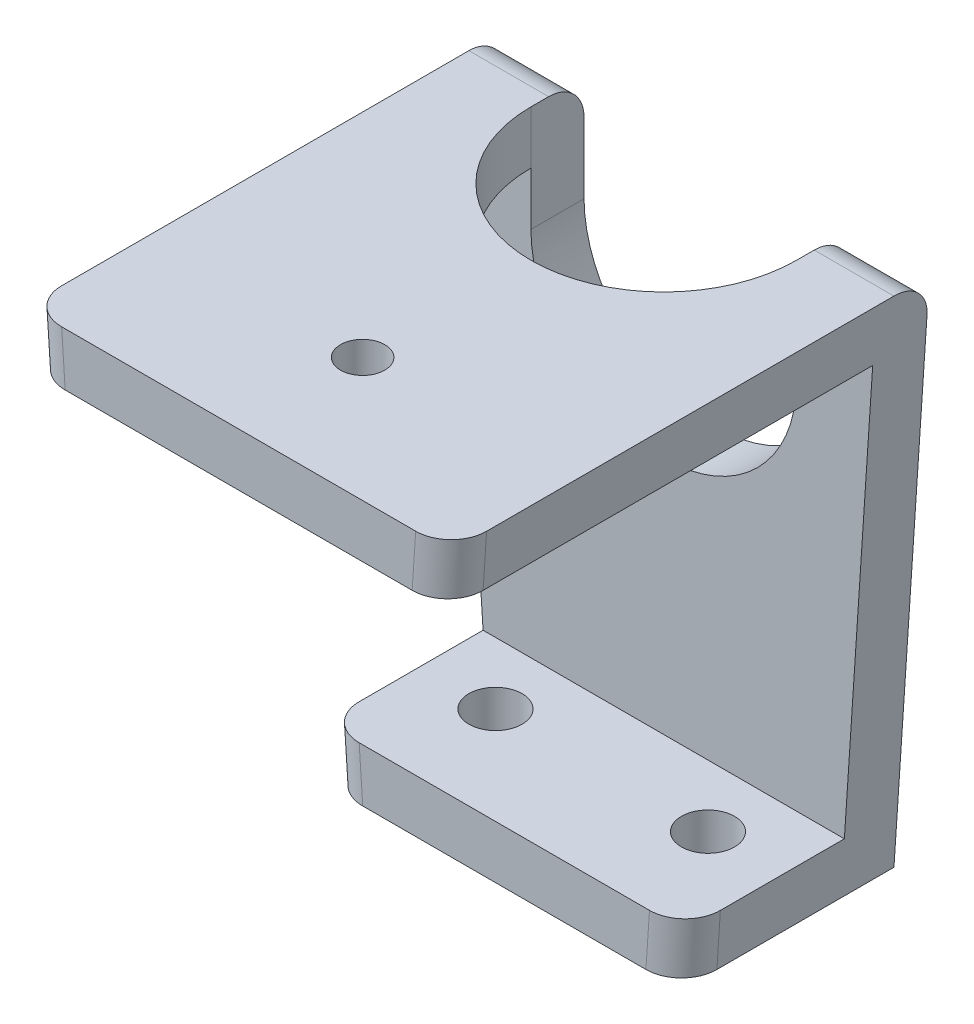
from build123d import *

# Parameters (mm, degrees)
SALIENTE_EXTRUIR1_DEPTH      = 3
SALIENTE_EXTRUIR2_DEPTH      = 9
SALIENTE_EXTRUIR3_DEPTH      = 24
CORTAR_EXTRUIR1_DEPTH        = 3
CORTAR_EXTRUIR_L_MINA1_START = -2.993325909
CORTAR_EXTRUIR_L_MINA1_DEPTH = 2.993325909
REDONDEO1_R                  = 2
CROQUIS6_R                   = 1.25
CORTAR_EXTRUIR2_DEPTH        = 3
CROQUIS7_R                   = 1.5
CORTAR_EXTRUIR3_DEPTH        = 3


# Read off the part's stored shape, not the designer's step: Cortar-Extruir-Lámina1
with BuildPart() as part:
    # Croquis1 → Saliente-Extruir1 (new body)
    with BuildSketch(Plane.XY):
        Polygon((0, 0), (20, 0), (22, 29.933259094), (-2, 29.933259094), align=None)
    extrude(amount=SALIENTE_EXTRUIR1_DEPTH)

    # Croquis2 → Saliente-Extruir2 (add)
    with BuildSketch(Plane.XY.offset(3)):
        Polygon((0, 0), (20, 0), (20.2, 2.993325909), (-0.2, 2.993325909), align=None)
    extrude(amount=SALIENTE_EXTRUIR2_DEPTH)

    # Croquis3 → Saliente-Extruir3 (add)
    with BuildSketch(Plane.XY.offset(3)):
        Polygon((22, 29.933259094), (21.8, 26.939933185), (-1.8, 26.939933185), (-2, 29.933259094), align=None)
    extrude(amount=SALIENTE_EXTRUIR3_DEPTH)

    # Croquis4 → Cortar-Extruir1 (cut)
    with BuildSketch(Plane.XY.offset(3)):
        with BuildLine():
            Line((17.5, 26.939933185), (17.5, 23.939933185))
            ThreePointArc((17.5, 23.939933185), (10, 16.499759469), (2.5, 23.939933185))
            Line((2.5, 23.939933185), (2.5, 26.939933185))
            Line((2.5, 26.939933185), (17.5, 26.939933185))
        make_face()
    extrude(amount=-CORTAR_EXTRUIR1_DEPTH, mode=Mode.SUBTRACT)

    # Cortar-Extruir-Lámina1 outline → Cortar-Extruir-Lámina1 (cut)
    with BuildSketch(Plane.XZ.offset(-26.939933185).offset(CORTAR_EXTRUIR_L_MINA1_START)):
        with BuildLine():
            Line((2.5, 0), (17.5, 0))
            Line((17.5, 0), (17.5, 3))
            ThreePointArc((17.5, 3), (10, 10.5), (2.5, 3))
            Line((2.5, 3), (2.5, 0))
        make_face()
    extrude(amount=CORTAR_EXTRUIR_L_MINA1_DEPTH, mode=Mode.SUBTRACT)

    # Redondeo1
    redondeo1_edges = [part.edges().sort_by_distance(p)[0] for p in [
        (-0.1, 1.496662955, 12),
        (20.1, 1.496662955, 12),
        (-1.9, 28.436596139, 27),
        (21.9, 28.436596139, 27),
        (19.75, 29.933259094, 0),
        (0.25, 29.933259094, 0),
    ]]
    fillet(redondeo1_edges, radius=REDONDEO1_R)

    # Croquis6 → Cortar-Extruir2 (cut)
    with BuildSketch(Plane.XZ.offset(-26.939933185)):
        with Locations((10, 20)):
            Circle(CROQUIS6_R)
    extrude(amount=-CORTAR_EXTRUIR2_DEPTH, mode=Mode.SUBTRACT)

    # Croquis7 → Cortar-Extruir3 (cut)
    with BuildSketch(Plane.XZ):
        with Locations(Location((4, 6.5, 0), (0, 0, 270))):
            Circle(CROQUIS7_R)
        with Locations((16, 6.5)):
            Circle(CROQUIS7_R)
    extrude(amount=-CORTAR_EXTRUIR3_DEPTH, mode=Mode.SUBTRACT)


solid = part.part
